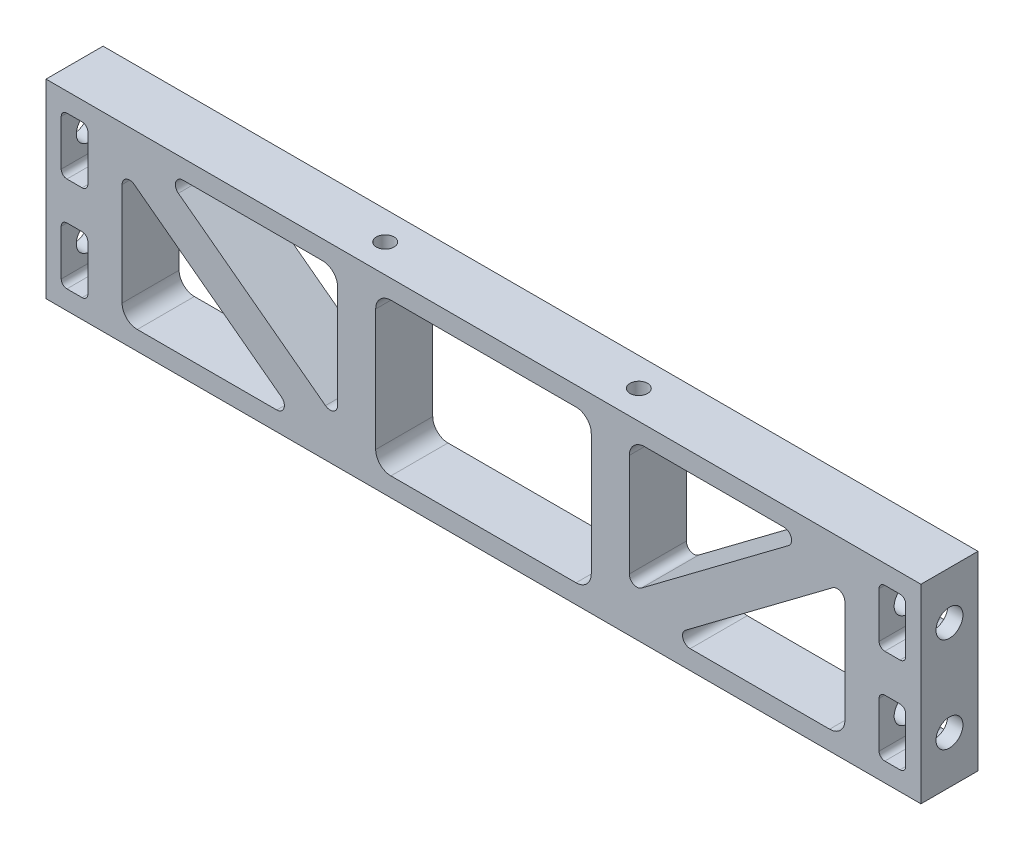
from build123d import *

# Parameters (mm, degrees)
BOSS_EXTRUDE2_DEPTH                        = 9.525
SKETCH3_R                                  = 2.2479
CUT_EXTRUDE1_DEPTH                         = 11.1125
MIRROR1_AT_THE_SECOND_PLANE_COPY_1_SKETC_R = 2.2479
MIRROR1_AT_THE_SECOND_PLANE_COPY_1_DEPTH   = 11.1125
SKETCH4_R                                  = 1.4732
CUT_EXTRUDE2_DEPTH                         = 12.7
MIRROR2_AT_THE_SECOND_PLANE_COPY_1_SKETC_R = 1.4732
MIRROR2_AT_THE_SECOND_PLANE_COPY_1_DEPTH   = 12.7


with BuildPart() as part:
    # Sketch2 → Boss-Extrude2 (new body)
    with BuildSketch(Plane.XY):
        Polygon((-63.5, 15.875), (-73.025, 15.875), (-73.025, -15.875), (-63.5, -15.875), (-21.166666667, -15.875), (0, -15.875), (73.025, -15.875), (73.025, 15.875), (-21.166666667, 15.875), (-24.341666667, 15.875), align=None)
        with BuildLine():
            Line((-66.04, -4.1275), (-66.04, -11.7475))
            ThreePointArc((-66.04, -11.7475), (-66.318980791, -12.421019209), (-66.9925, -12.7))
            Line((-66.9925, -12.7), (-69.5325, -12.7))
            ThreePointArc((-69.5325, -12.7), (-70.206019209, -12.421019209), (-70.485, -11.7475))
            Line((-70.485, -11.7475), (-70.485, -4.1275))
            ThreePointArc((-70.485, -4.1275), (-70.206019209, -3.453980791), (-69.5325, -3.175))
            Line((-69.5325, -3.175), (-66.9925, -3.175))
            ThreePointArc((-66.9925, -3.175), (-66.318980791, -3.453980791), (-66.04, -4.1275))
        make_face(mode=Mode.SUBTRACT)
        with BuildLine():
            ThreePointArc((-57.785, -12.7), (-59.581051224, -11.956051224), (-60.325, -10.16))
            Line((-60.325, -10.16), (-60.325, 6.985))
            ThreePointArc((-60.325, 6.985), (-59.622961266, 8.120922533), (-58.293, 8.001))
            Line((-58.293, 8.001), (-33.739666667, -10.414))
            ThreePointArc((-33.739666667, -10.414), (-33.296838878, -11.831609263), (-34.501666667, -12.7))
            Line((-34.501666667, -12.7), (-57.785, -12.7))
        make_face(mode=Mode.SUBTRACT)
        with BuildLine():
            ThreePointArc((70.485, -11.7475), (70.206019209, -12.421019209), (69.5325, -12.7))
            Line((69.5325, -12.7), (66.9925, -12.7))
            ThreePointArc((66.9925, -12.7), (66.318980791, -12.421019209), (66.04, -11.7475))
            Line((66.04, -11.7475), (66.04, -4.1275))
            ThreePointArc((66.04, -4.1275), (66.318980791, -3.453980791), (66.9925, -3.175))
            Line((66.9925, -3.175), (69.5325, -3.175))
            ThreePointArc((69.5325, -3.175), (70.206019209, -3.453980791), (70.485, -4.1275))
            Line((70.485, -4.1275), (70.485, -11.7475))
        make_face(mode=Mode.SUBTRACT)
        with BuildLine():
            ThreePointArc((60.325, -10.16), (59.581051224, -11.956051224), (57.785, -12.7))
            Line((57.785, -12.7), (34.501666667, -12.7))
            ThreePointArc((34.501666667, -12.7), (33.296838878, -11.831609263), (33.739666667, -10.414))
            Line((33.739666667, -10.414), (58.293, 8.001))
            ThreePointArc((58.293, 8.001), (59.622961266, 8.120922533), (60.325, 6.985))
            Line((60.325, 6.985), (60.325, -10.16))
        make_face(mode=Mode.SUBTRACT)
        with BuildLine():
            Line((-26.373666667, -8.001), (-50.927, 10.414))
            ThreePointArc((-50.927, 10.414), (-51.369827789, 11.831609263), (-50.165, 12.7))
            Line((-50.165, 12.7), (-26.881666667, 12.7))
            ThreePointArc((-26.881666667, 12.7), (-25.085615442, 11.956051224), (-24.341666667, 10.16))
            Line((-24.341666667, 10.16), (-24.341666667, -6.985))
            ThreePointArc((-24.341666667, -6.985), (-25.0437054, -8.120922533), (-26.373666667, -8.001))
        make_face(mode=Mode.SUBTRACT)
        with BuildLine():
            ThreePointArc((-70.485, 11.7475), (-70.206019209, 12.421019209), (-69.5325, 12.7))
            Line((-69.5325, 12.7), (-66.9925, 12.7))
            ThreePointArc((-66.9925, 12.7), (-66.318980791, 12.421019209), (-66.04, 11.7475))
            Line((-66.04, 11.7475), (-66.04, 4.1275))
            ThreePointArc((-66.04, 4.1275), (-66.318980791, 3.453980791), (-66.9925, 3.175))
            Line((-66.9925, 3.175), (-69.5325, 3.175))
            ThreePointArc((-69.5325, 3.175), (-70.206019209, 3.453980791), (-70.485, 4.1275))
            Line((-70.485, 4.1275), (-70.485, 11.7475))
        make_face(mode=Mode.SUBTRACT)
        with BuildLine():
            Line((15.451666667, -12.7), (0, -12.7))
            Line((0, -12.7), (-15.451666667, -12.7))
            ThreePointArc((-15.451666667, -12.7), (-17.247717891, -11.956051224), (-17.991666667, -10.16))
            Line((-17.991666667, -10.16), (-17.991666667, 10.16))
            ThreePointArc((-17.991666667, 10.16), (-17.247717891, 11.956051224), (-15.451666667, 12.7))
            Line((-15.451666667, 12.7), (15.451666667, 12.7))
            ThreePointArc((15.451666667, 12.7), (17.247717891, 11.956051224), (17.991666667, 10.16))
            Line((17.991666667, 10.16), (17.991666667, -10.16))
            ThreePointArc((17.991666667, -10.16), (17.247717891, -11.956051224), (15.451666667, -12.7))
        make_face(mode=Mode.SUBTRACT)
        with BuildLine():
            Line((24.341666667, -6.985), (24.341666667, 10.16))
            ThreePointArc((24.341666667, 10.16), (25.085615442, 11.956051224), (26.881666667, 12.7))
            Line((26.881666667, 12.7), (50.165, 12.7))
            ThreePointArc((50.165, 12.7), (51.369827789, 11.831609263), (50.927, 10.414))
            Line((50.927, 10.414), (26.373666667, -8.001))
            ThreePointArc((26.373666667, -8.001), (25.0437054, -8.120922533), (24.341666667, -6.985))
        make_face(mode=Mode.SUBTRACT)
        with BuildLine():
            Line((66.04, 4.1275), (66.04, 11.7475))
            ThreePointArc((66.04, 11.7475), (66.318980791, 12.421019209), (66.9925, 12.7))
            Line((66.9925, 12.7), (69.5325, 12.7))
            ThreePointArc((69.5325, 12.7), (70.206019209, 12.421019209), (70.485, 11.7475))
            Line((70.485, 11.7475), (70.485, 4.1275))
            ThreePointArc((70.485, 4.1275), (70.206019209, 3.453980791), (69.5325, 3.175))
            Line((69.5325, 3.175), (66.9925, 3.175))
            ThreePointArc((66.9925, 3.175), (66.318980791, 3.453980791), (66.04, 4.1275))
        make_face(mode=Mode.SUBTRACT)
    extrude(amount=BOSS_EXTRUDE2_DEPTH)

    # Sketch3 → Cut-Extrude1 (cut)
    with BuildSketch(Plane.ZY.offset(73.025)):
        with Locations((4.7625, 7.9375)):
            Circle(SKETCH3_R)
    cut_extrude1 = extrude(amount=-CUT_EXTRUDE1_DEPTH, mode=Mode.SUBTRACT)

    # Mirror1: Cut-Extrude1 across plane
    add(cut_extrude1.mirror(Plane(origin=(0, 0, 0), x_dir=(0, 0, 1), z_dir=(1, 0, 0))), mode=Mode.SUBTRACT)

    # Mirror1 at the second plane: Cut-Extrude1 across plane
    add(cut_extrude1.mirror(Plane.ZX), mode=Mode.SUBTRACT)

    # Mirror1 at the second plane copy 1 sketc → Mirror1 at the second plane copy 1 (cut)
    with BuildSketch(Plane(origin=(73.025, 0, 0), x_dir=(0, 0, 1), z_dir=(1, 0, 0))):
        with Locations((4.7625, 7.9375)):
            Circle(MIRROR1_AT_THE_SECOND_PLANE_COPY_1_SKETC_R)
    extrude(amount=-MIRROR1_AT_THE_SECOND_PLANE_COPY_1_DEPTH, mode=Mode.SUBTRACT)

    # Sketch4 → Cut-Extrude2 (cut)
    with BuildSketch(Plane(origin=(0, 15.875, 0), x_dir=(1, 0, 0), z_dir=(0, 1, 0))):
        with Locations((21.166666667, -4.7625)):
            Circle(SKETCH4_R)
    cut_extrude2 = extrude(amount=-CUT_EXTRUDE2_DEPTH, mode=Mode.SUBTRACT)

    # Mirror2: Cut-Extrude2 across plane
    add(cut_extrude2.mirror(Plane.ZX), mode=Mode.SUBTRACT)

    # Mirror2 at the second plane: Cut-Extrude2 across plane
    add(cut_extrude2.mirror(Plane(origin=(0, 0, 0), x_dir=(0, 0, 1), z_dir=(1, 0, 0))), mode=Mode.SUBTRACT)

    # Mirror2 at the second plane copy 1 sketc → Mirror2 at the second plane copy 1 (cut)
    with BuildSketch(Plane(origin=(0, -15.875, 0), x_dir=(-1, 0, 0), z_dir=(0, -1, 0))):
        with Locations((21.166666667, -4.7625)):
            Circle(MIRROR2_AT_THE_SECOND_PLANE_COPY_1_SKETC_R)
    extrude(amount=-MIRROR2_AT_THE_SECOND_PLANE_COPY_1_DEPTH, mode=Mode.SUBTRACT)


solid = part.part
